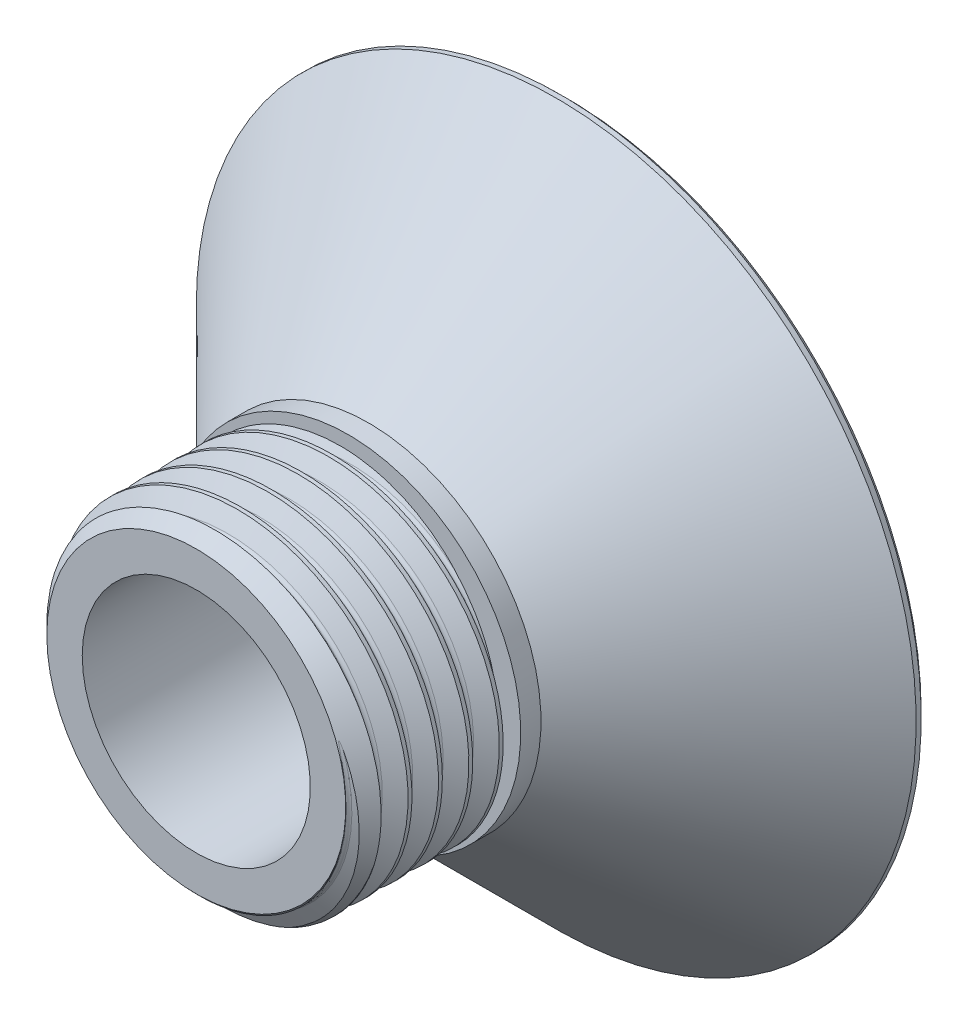
from build123d import *

# Parameters (mm, degrees)
SWEEP5_PITCH            = 3
CUT_EXTRUDE1_DEPTH      = 64.880746738
CUT_EXTRUDE1_DEPTH_BACK = 64.880746738
CHAMFER1_SIZE           = 0.5


with BuildPart() as part:
    # Sketch1 → Revolve1 (revolve)
    with BuildSketch(Plane(origin=(0, 0, 0), x_dir=(0, 0, -1), z_dir=(1, 0, 0)), mode=Mode.PRIVATE) as revolve1_sk:
        Polygon((0, 6.5), (0, 35.5), (-1, 35.5), (-19.5, 17), (-21.5, 17), (-21.5, 14.75), (-36.5, 14.75), (-36.5, 11.25), (-2, 11.25), (-2, 6.5), align=None)
    revolve(revolve1_sk.sketch.rotate(Axis((0, 0, 0), (0, 0, 1)), 90), axis=Axis((0, 0, 0), (0, 0, 1)))

    # Sweep5: arcs per turn and ends read off the stored shape
    # Sweep5: the profile of Sketch4 screwed along a right-hand helix through 6 turns, 10 arcs to a turn; built about Z, then put on its axis
    sweep5_z = Axis((0, 0, 0), (0, 0, 1))
    sweep5_corners = [(14.965762977, -8.0973e-05, -0.374125558), (16.579762977, -8.9705e-05, -1.305968892), (16.579762977, -8.9705e-05, -1.684036274), (14.965762977, -8.0973e-05, -2.615879609), (14.749762977, -7.9804e-05, -2.990002583), (14.749762977, -7.9804e-05, -2.583e-06)]
    with BuildLine(mode=Mode.PRIVATE) as sweep5_profile:
        Line(sweep5_corners[0], sweep5_corners[1])
        Line(sweep5_corners[1], sweep5_corners[2])
        Line(sweep5_corners[2], sweep5_corners[3])
        Line(sweep5_corners[4], sweep5_corners[5])
        ThreePointArc((14.965762977, -8.0973e-05, -2.615879609), (14.807640002, -8.0117e-05, -2.774002583), (14.749762977, -7.9804e-05, -2.990002583))
        ThreePointArc((14.749762977, -7.9804e-05, -2.583e-06), (14.807640002, -8.0117e-05, -0.216002583), (14.965762977, -8.0973e-05, -0.374125558))
    sweep5_cap = Face(sweep5_profile.wire())
    sweep5_arcs = [((14.965762977, -8.0973e-05, -2.615879609), (14.749762977, -7.9804e-05, -2.740587267), (14.749762977, -7.9804e-05, -2.990002583), (1, 0.8660254037844503, 1)), ((14.749762977, -7.9804e-05, -2.583e-06), (14.749762977, -7.9804e-05, -0.2494179), (14.965762977, -8.0973e-05, -0.374125558), (1, 0.8660254037844246, 1))]  # start, shoulder, end, weights
    sweep5_turn_angles = [0, 18, 36, 54, 72, 90, 108, 126, 144, 162, 180, 198, 216, 234, 252, 270, 288, 306, 324, 342, 360]
    sweep5_turn_weights = [1, 0.9510565162951535, 1, 0.9510565162951535, 1, 0.9510565162951535, 1, 0.9510565162951535, 1, 0.9510565162951535, 1, 0.9510565162951535, 1, 0.9510565162951535, 1, 0.9510565162951535, 1, 0.9510565162951535, 1, 0.9510565162951535, 1]
    sweep5_turn_rails = [Edge.make_bspline([Vector(p[0], p[1], 0).rotate(sweep5_z, sweep5_turn_angles[k]) / sweep5_turn_weights[k] + Vector(0, 0, p[2] + SWEEP5_PITCH * sweep5_turn_angles[k] / 360) for k in range(21)], [0, 0, 0, 1, 1, 2, 2, 3, 3, 4, 4, 5, 5, 6, 6, 7, 7, 8, 8, 9, 9, 10, 10, 10], 2, sweep5_turn_weights) for p in sweep5_corners]
    sweep5_turn_sides = [*[Face.make_surface_from_curves(sweep5_turn_rails[p[0]], sweep5_turn_rails[p[1]]) for p in [(0, 1), (1, 2), (2, 3), (4, 5)]], *[Face.make_bezier_surface([[Vector(p[j][0], p[j][1], 0).rotate(sweep5_z, sweep5_turn_angles[2 * i + k]) / sweep5_turn_weights[2 * i + k] + Vector(0, 0, p[j][2] + SWEEP5_PITCH * sweep5_turn_angles[2 * i + k] / 360) for k in range(3)] for j in range(3)], [[p[3][j] * sweep5_turn_weights[2 * i + k] for k in range(3)] for j in range(3)]) for p in sweep5_arcs for i in range(10)]]
    sweep5 = Plane(origin=(0, 0, 21.5), x_dir=(1, 0, 0), z_dir=(0, 0, 1)) * Solid(Shell([*[p.moved(Location((0, 0, SWEEP5_PITCH * i))) for i in range(6) for p in sweep5_turn_sides], sweep5_cap, sweep5_cap.rotate(sweep5_z, 2160).moved(Location((0, 0, SWEEP5_PITCH * 2160 / 360)))]))
    add(sweep5)

    # Sketch11 → Cut-Extrude1 (cut, two sides: drawn at the far end of the back side and taken through both)
    with BuildSketch(Plane(origin=(0, 0, 0), x_dir=(1, 0, 0), z_dir=(0, 1, 0)).offset(-CUT_EXTRUDE1_DEPTH_BACK)):
        Polygon((155.419999662, -36.5), (17.20325686, -36.5), (-17.023158961, -36.5), (-155.239901763, -36.5), (-155.239901763, -312.933485603), (155.419999662, -312.933485603), align=None)
    extrude(amount=CUT_EXTRUDE1_DEPTH + CUT_EXTRUDE1_DEPTH_BACK, mode=Mode.SUBTRACT)

    # Sketch12 → Cut-Revolve1 (revolve, cut)
    with BuildSketch(Plane(origin=(0, 0, 0), x_dir=(1, 0, 0), z_dir=(0, 1, 0)), mode=Mode.PRIVATE) as cut_revolve1_sk:
        Polygon((14.742984124, -36.5), (17.242984124, -34), (17.242984124, -36.5), align=None)
    revolve(cut_revolve1_sk.sketch.rotate(Axis((0, 0, 0), (0, 0, 1)), 180), axis=Axis((0, 0, 0), (0, 0, 1)), mode=Mode.SUBTRACT)

    # Chamfer1
    chamfer1_edges = [part.edges().sort_by_distance(p)[0] for p in [
        (35.5, 0, 0),
        (6.5, 0, 0),
    ]]
    chamfer(chamfer1_edges, length=CHAMFER1_SIZE)


solid = part.part
